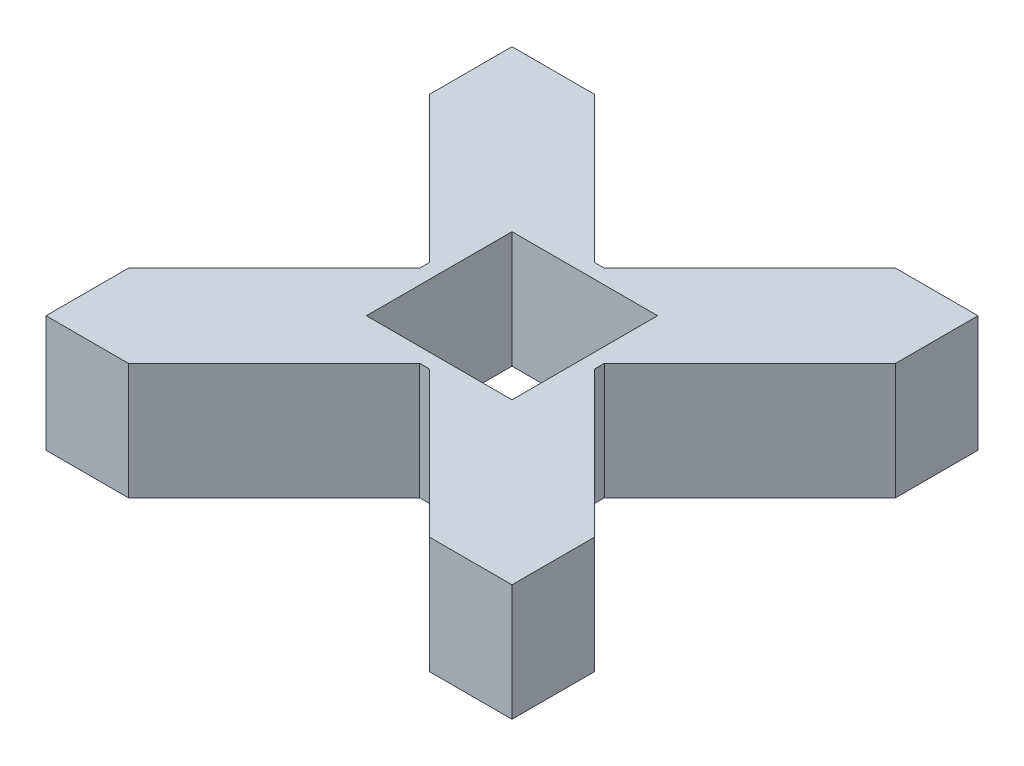
from build123d import *

# Parameters (mm, degrees)
BOSS_EXTRUDE1_DEPTH = 20
SKETCH2_W           = 25
SKETCH2_H           = 25
CUT_EXTRUDE2_DEPTH  = 61


with BuildPart() as part:
    # Sketch1 → Boss-Extrude1 (new body)
    with BuildSketch(Plane(origin=(0, 0, 0), x_dir=(1, 0, 0), z_dir=(0, 1, 0))):
        Polygon((40, -40), (40, -25.857864376), (15, -0.857864376), (15, 0.857864376), (40, 25.857864376), (40, 40), (25.857864376, 40), (0.857864376, 15), (-0.857864376, 15), (-25.857864376, 40), (-40, 40), (-40, 25.857864376), (-15, 0.857864376), (-15, -0.857864376), (-40, -25.857864376), (-40, -40), (-25.857864376, -40), (-0.857864376, -15), (0.857864376, -15), (25.857864376, -40), align=None)
    extrude(amount=BOSS_EXTRUDE1_DEPTH)

    # Sketch2 → Cut-Extrude2 (cut, through all)
    with BuildSketch(Plane(origin=(0, 20, 0), x_dir=(1, 0, 0), z_dir=(0, 1, 0))):
        Rectangle(SKETCH2_W, SKETCH2_H)
    extrude(amount=-CUT_EXTRUDE2_DEPTH, mode=Mode.SUBTRACT)


solid = part.part
